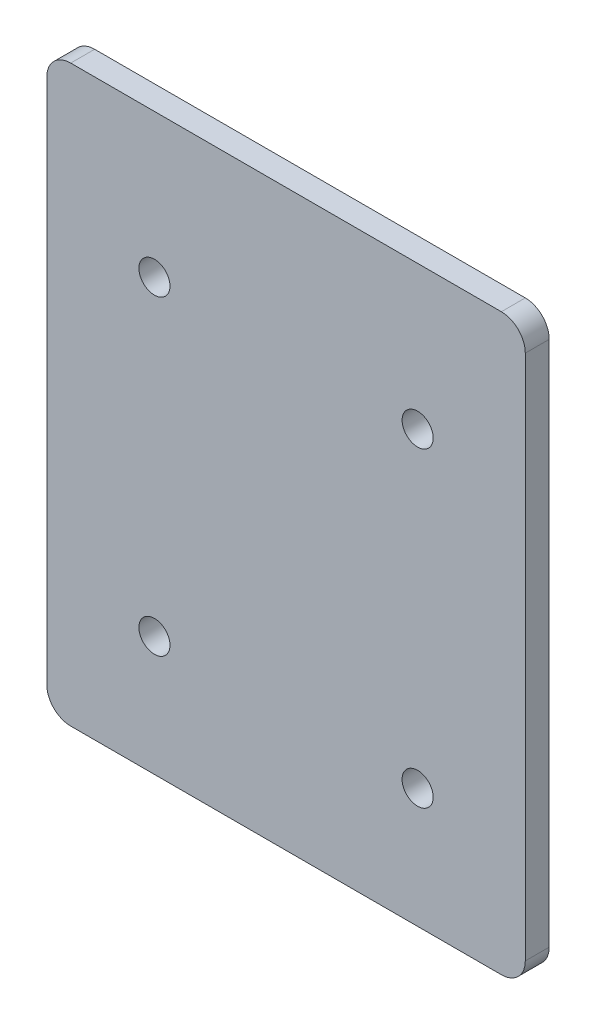
from build123d import *

# Parameters (mm, degrees)
SKETCH1_W          = 100
SKETCH1_H          = 120
SKETCH1_R          = 3.25
BASE_FLANGE1_DEPTH = 5
FILLET1_R          = 5


# Sheet-metal steps are written as plain solids
with BuildPart() as part:
    # Sketch1 → Base-Flange1 (new body)
    with BuildSketch(Plane.XY):
        Rectangle(SKETCH1_W, SKETCH1_H)
        with Locations((-27.5, 30)):
            Circle(SKETCH1_R, mode=Mode.SUBTRACT)
        with Locations((27.5, 30)):
            Circle(SKETCH1_R, mode=Mode.SUBTRACT)
        with Locations((-27.5, -35)):
            Circle(SKETCH1_R, mode=Mode.SUBTRACT)
        with Locations((27.5, -35)):
            Circle(SKETCH1_R, mode=Mode.SUBTRACT)
    extrude(amount=-BASE_FLANGE1_DEPTH)

    # Fillet1
    fillet1_edges = [part.edges().sort_by_distance(p)[0] for p in [
        (50, -60, -2.5),
        (-50, -60, -2.5),
        (-50, 60, -2.5),
        (50, 60, -2.5),
    ]]
    fillet(fillet1_edges, radius=FILLET1_R)


solid = part.part
